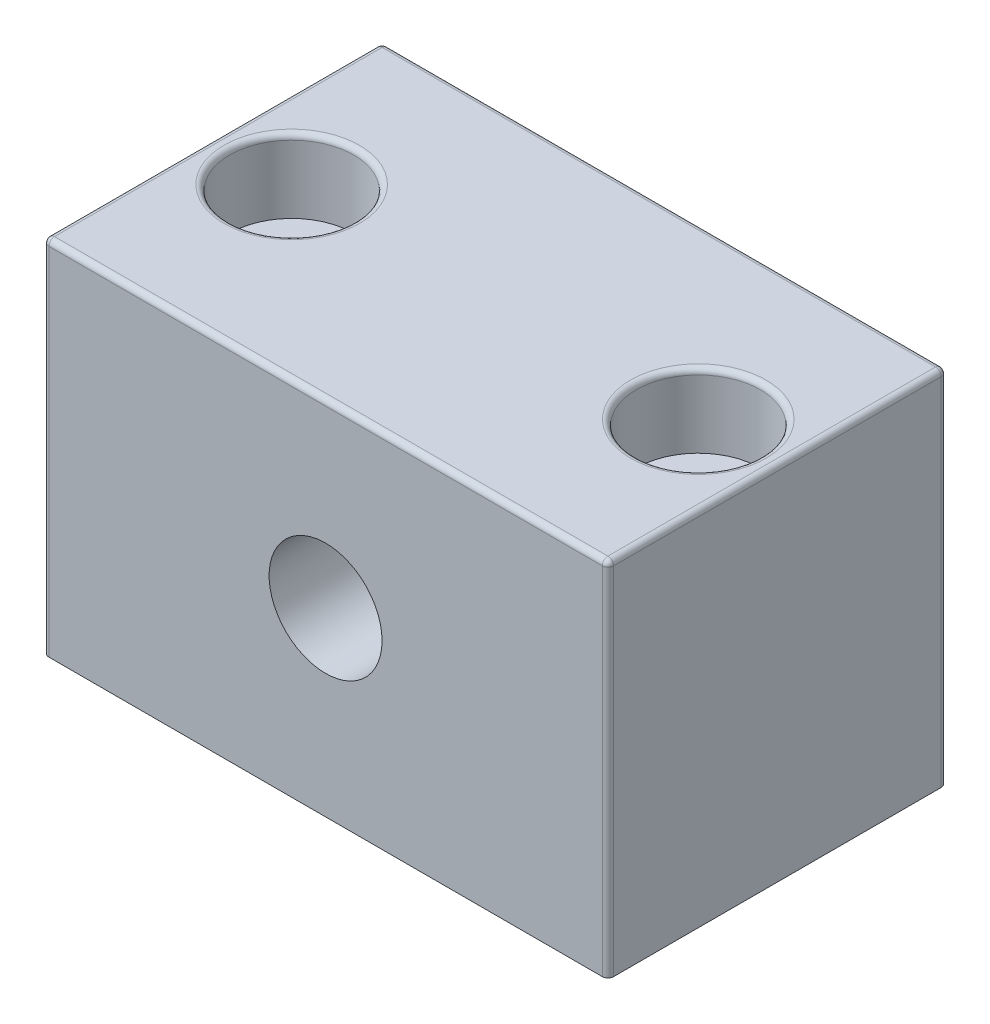
from build123d import *

# Parameters (mm, degrees)
BOSS_EXTRUDE1_DEPTH      = 15
BOSS_EXTRUDE1_DEPTH_BACK = 15
SKETCH1_W                = 50
SKETCH1_H                = 32
SKETCH2_R                = 5
CUT_EXTRUDE1_DEPTH       = 67.513156593
SKETCH3_R                = 5.5
CUT_EXTRUDE2_DEPTH       = 6.5
SKETCH4_R                = 3.3
CUT_EXTRUDE3_DEPTH       = 59.096901811
FILLET1_R                = 0.5


with BuildPart() as part:
    # Sketch1 → Boss-Extrude1 (new, two sides: drawn at the far end of the back side and taken through both)
    with BuildSketch(Plane.XY.offset(-BOSS_EXTRUDE1_DEPTH_BACK)):
        with Locations((25, 16)):
            Rectangle(SKETCH1_W, SKETCH1_H)
    extrude(amount=BOSS_EXTRUDE1_DEPTH + BOSS_EXTRUDE1_DEPTH_BACK)

    # Sketch2 → Cut-Extrude1 (cut, through all)
    with BuildSketch(Plane.XY.offset(15)):
        with Locations((25, 16)):
            Circle(SKETCH2_R)
    extrude(amount=-CUT_EXTRUDE1_DEPTH, mode=Mode.SUBTRACT)

    # Sketch3 → Cut-Extrude2 (cut)
    with BuildSketch(Plane(origin=(0, 32, 0), x_dir=(1, 0, 0), z_dir=(0, 1, 0))):
        with Locations((43, 0)):
            Circle(SKETCH3_R)
    cut_extrude2 = extrude(amount=-CUT_EXTRUDE2_DEPTH, mode=Mode.SUBTRACT)

    # Sketch4 → Cut-Extrude3 (cut, through all)
    with BuildSketch(Plane(origin=(0, 25.5, 0), x_dir=(1, 0, 0), z_dir=(0, 1, 0))):
        with Locations((43, 0)):
            Circle(SKETCH4_R)
    cut_extrude3 = extrude(amount=-CUT_EXTRUDE3_DEPTH, mode=Mode.SUBTRACT)

    # Mirror1: Cut-Extrude2, Cut-Extrude3 across plane
    add(cut_extrude2.mirror(Plane(origin=(25.000000038, 0, 0), x_dir=(0, 0, 1), z_dir=(1, 0, 0))), mode=Mode.SUBTRACT)
    add(cut_extrude3.mirror(Plane(origin=(25.000000038, 0, 0), x_dir=(0, 0, 1), z_dir=(1, 0, 0))), mode=Mode.SUBTRACT)

    # Fillet1
    fillet1_edges = [part.edges().sort_by_distance(p)[0] for p in [
        (12.500000076, 32, 0),
        (37.5, 32, 0),
        (25, 32, -15),
        (50, 32, 0),
        (25, 32, 15),
        (0, 32, 0),
        (0, 16, -15),
        (50, 16, -15),
        (50, 16, 15),
        (0, 16, 15),
    ]]
    fillet(fillet1_edges, radius=FILLET1_R)


solid = part.part
